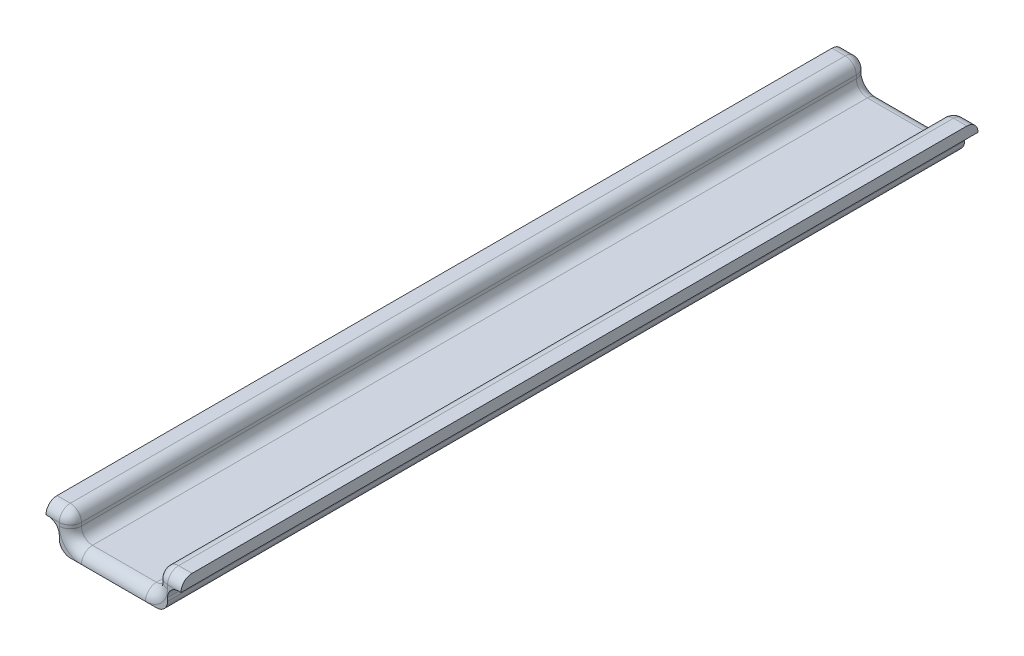
from build123d import *

# Parameters (mm, degrees)
EXTRUDE_THIN2_DEPTH      = 180.34
EXTRUDE_THIN2_DEPTH_BACK = 2.54
FILLET1_R                = 2.54
FILLET2_R                = 2.54
FILLET3_R                = 2.54
FILLET4_R                = 2.54
FILLET5_R                = 2.54
FILLET6_R                = 2.54
FILLET7_R                = 2.54


with BuildPart() as part:
    # Sketch2 → Extrude-Thin2 (new, two sides: drawn at the far end of the back side and taken through both)
    with BuildSketch(Plane.XY.offset(-EXTRUDE_THIN2_DEPTH_BACK)):
        Polygon((-12.274730593, 5.817033739), (-9.228474815, 5.817033739), (-9.228474815, 0), (15.619605828, 0), (15.619605828, 5.848528279), (18.694831425, 5.848528279), (18.694831425, 8.388528279), (13.079605828, 8.388528279), (13.079605828, 2.54), (-6.688474815, 2.54), (-6.688474815, 8.357033739), (-12.274730593, 8.357033739), align=None)
    extrude(amount=EXTRUDE_THIN2_DEPTH + EXTRUDE_THIN2_DEPTH_BACK)

    # Fillet1
    fillet1_edges = [part.edges().sort_by_distance(p)[0] for p in [
        (-6.688474815, 2.54, 88.9),
        (13.079605828, 2.54, 88.9),
        (13.079605828, 5.46426414, 180.34),
        (3.195565506, 2.54, 180.34),
        (-6.688474815, 5.44851687, 180.34),
        (13.079605828, 5.46426414, -2.54),
        (3.195565506, 2.54, -2.54),
        (-6.688474815, 5.44851687, -2.54),
    ]]
    fillet(fillet1_edges, radius=FILLET1_R - 0.0001)  # a hair under: the kernel refuses the full size

    # Fillet2
    fillet2_edges = [part.edges().sort_by_distance(p)[0] for p in [
        (15.619605828, 5.848528279, 88.9),
    ]]
    fillet(fillet2_edges, radius=FILLET2_R)

    # Fillet3
    fillet3_edges = [part.edges().sort_by_distance(p)[0] for p in [
        (17.157168626, 8.388528279, -2.54),
        (17.157168626, 8.388528279, 180.34),
        (13.079605828, 8.388528279, 88.9),
        (13.823525314, 8.388528279, 179.596080514),
        (13.823525314, 8.388528279, -1.796080514),
    ]]
    fillet(fillet3_edges, radius=FILLET3_R - 0.0001)  # a hair under: the kernel refuses the full size

    # Fillet4
    fillet4_edges = [part.edges().sort_by_distance(p)[0] for p in [
        (15.619605828, 0, 88.9),
    ]]
    fillet(fillet4_edges, radius=FILLET4_R)

    # Fillet5
    fillet5_edges = [part.edges().sort_by_distance(p)[0] for p in [
        (-10.751552704, 8.357033739, -2.54),
        (-6.688474815, 8.357033739, 88.9),
        (-10.751552704, 8.357033739, 180.34),
        (-7.432394301, 8.357033739, 179.596080514),
        (-7.432394301, 8.357033739, -1.796080514),
    ]]
    fillet(fillet5_edges, radius=FILLET5_R - 0.0001)  # a hair under: the kernel refuses the full size

    # Fillet6
    fillet6_edges = [part.edges().sort_by_distance(p)[0] for p in [
        (-9.228474815, 0, 88.9),
    ]]
    fillet(fillet6_edges, radius=FILLET6_R)

    # Fillet7
    fillet7_edges = [part.edges().sort_by_distance(p)[0] for p in [
        (-9.228474815, 5.817033739, 88.9),
    ]]
    fillet(fillet7_edges, radius=FILLET7_R)


solid = part.part
